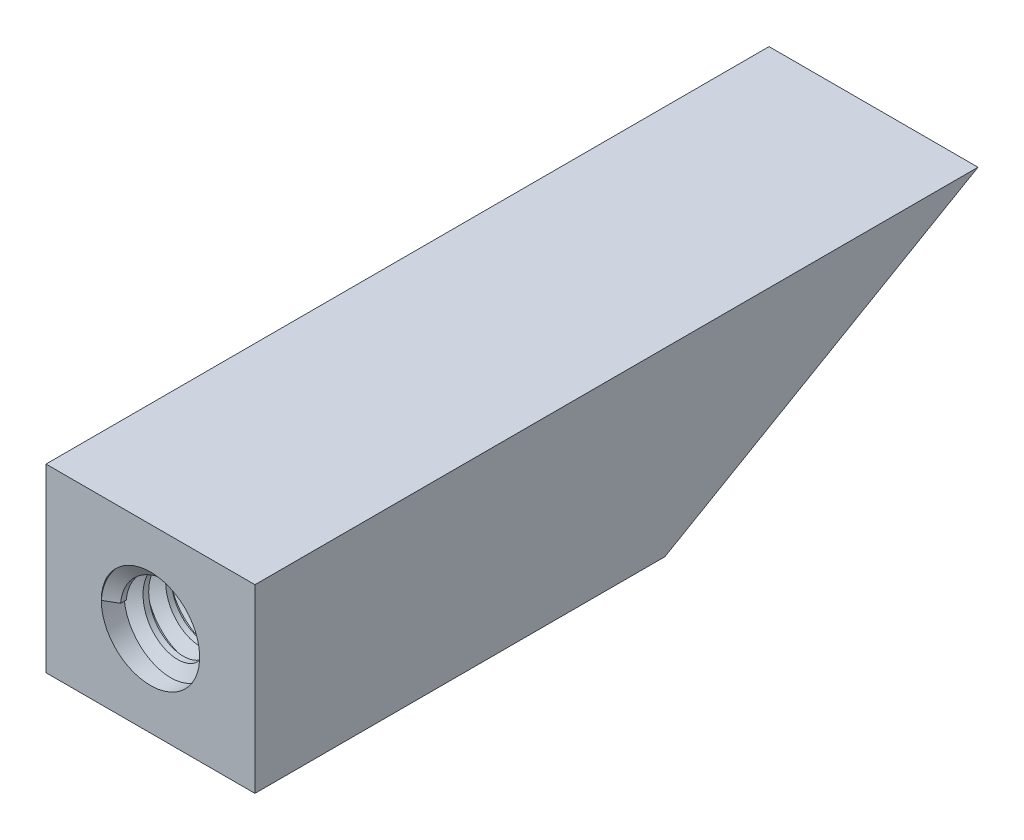
from build123d import *
from build123d.topology import SkipClean

# Parameters (mm, degrees)
SKETCH1_W               = 7.3406
SKETCH1_H               = 6.35
BOSS_EXTRUDE1_DEPTH     = 25.4
SKETCH3_R               = 1.7272
CUT_EXTRUDE2_DEPTH      = 25.4
THREAD1_PITCH           = 0.79375
CUT_EXTRUDE3_DEPTH      = 27.629567015
CUT_EXTRUDE3_DEPTH_BACK = 7.3406
SKETCH2_W               = 2.54
SKETCH2_H               = 6.35


with BuildPart() as part:
    # Sketch1 → Boss-Extrude1 (new body)
    with BuildSketch(Plane.XY):
        Rectangle(SKETCH1_W, SKETCH1_H)
    extrude(amount=BOSS_EXTRUDE1_DEPTH)

    # Sketch3 → Cut-Extrude2 (cut)
    with BuildSketch(Plane.XY.offset(25.4)):
        Circle(SKETCH3_R)
    extrude(amount=-CUT_EXTRUDE2_DEPTH, mode=Mode.SUBTRACT)

    # Thread1: the profile of Thread Profile3 profile screwed along a right-hand helix of 32 turns, 8 arcs to a turn; built about Z, then put on its axis
    with SkipClean():  # the faces are left unmerged after this step: merging them gives an invalid solid
        thread1_z = Axis((0, 0, 0), (0, 0, 1))
        thread1_corners = [(1.7275, 0, -0.000173205), (1.7275, 0, 0.694704453), (1.297570212, 0, 0.446484374), (1.297570212, 0, 0.248046874)]
        with BuildLine(mode=Mode.PRIVATE) as thread1_profile:
            Line(thread1_corners[0], thread1_corners[1])
            Line(thread1_corners[1], thread1_corners[2])
            Line(thread1_corners[2], thread1_corners[3])
            Line(thread1_corners[3], thread1_corners[0])
        thread1_cap = Face(thread1_profile.wire())
        thread1_turn_angles = [0, 22.5, 45, 67.5, 90, 112.5, 135, 157.5, 180, 202.5, 225, 247.5, 270, 292.5, 315, 337.5, 360]
        thread1_turn_weights = [1, 0.9238795325112867, 1, 0.9238795325112867, 1, 0.9238795325112867, 1, 0.9238795325112867, 1, 0.9238795325112867, 1, 0.9238795325112867, 1, 0.9238795325112867, 1, 0.9238795325112867, 1]
        thread1_turn_rails = [Edge.make_bspline([Vector(p[0], p[1], 0).rotate(thread1_z, thread1_turn_angles[k]) / thread1_turn_weights[k] + Vector(0, 0, p[2] + THREAD1_PITCH * thread1_turn_angles[k] / 360) for k in range(17)], [0, 0, 0, 1, 1, 2, 2, 3, 3, 4, 4, 5, 5, 6, 6, 7, 7, 8, 8, 8], 2, thread1_turn_weights) for p in thread1_corners]
        thread1_turn_sides = [Face.make_surface_from_curves(thread1_turn_rails[p[0]], thread1_turn_rails[p[1]]) for p in [(0, 1), (1, 2), (2, 3), (3, 0)]]
        thread1 = Plane(origin=(0, 0, 25.4), x_dir=(-1, 0, 0), z_dir=(0, 0, -1)) * Solid(Shell([*[p.moved(Location((0, 0, THREAD1_PITCH * i))) for i in range(32) for p in thread1_turn_sides], thread1_cap, thread1_cap.rotate(thread1_z, 11520).moved(Location((0, 0, THREAD1_PITCH * 11520 / 360)))]))
        add(thread1)

    # Sketch2 → Cut-Extrude3 (cut, two sides: drawn at the far end of the back side and taken through both)
    with SkipClean():  # the faces are left unmerged after this step: merging them gives an invalid solid
        with BuildSketch(Plane(origin=(3.6703, 0, 0), x_dir=(0, 0, -1), z_dir=(1, 0, 0)).offset(-CUT_EXTRUDE3_DEPTH_BACK)):
            Polygon((0, -3.175), (0, 3.175), (-10.998522628, -3.175), align=None)
            with Locations((1.27, 0)):
                Rectangle(SKETCH2_W, SKETCH2_H)
        extrude(amount=CUT_EXTRUDE3_DEPTH + CUT_EXTRUDE3_DEPTH_BACK, mode=Mode.SUBTRACT)


solid = part.part
